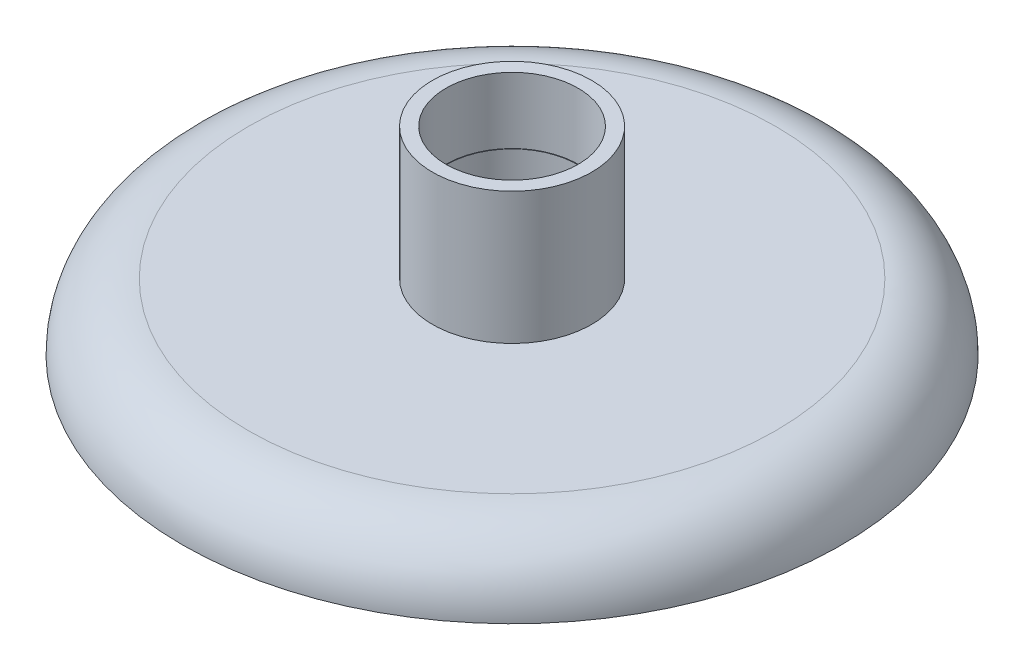
from build123d import *

# Parameters (mm, degrees)
SKETCH1_R           = 63.475313381
BOSS_EXTRUDE1_DEPTH = 12.7
FILLET2_R           = 12.7
SHELL2_T            = -6.35
SKETCH2_R           = 12.710048884
CUT_EXTRUDE1_DEPTH  = 12.7
SKETCH4_R           = 15.331222423
BOSS_EXTRUDE2_DEPTH = 25.4
SKETCH5_R           = 12.620209495
CUT_EXTRUDE2_DEPTH  = 27.94
SKETCH11_R          = 12.723642388
CUT_EXTRUDE4_DEPTH  = 12.7


with BuildPart() as part:
    # Sketch1 → Boss-Extrude1 (new body)
    with BuildSketch(Plane(origin=(0, 0, 0), x_dir=(1, 0, 0), z_dir=(0, 1, 0))):
        with Locations(Location((0, 0, 0), (0, 0, 270))):
            Circle(SKETCH1_R)
    extrude(amount=BOSS_EXTRUDE1_DEPTH)

    # Fillet2
    fillet2_edges = [part.edges().sort_by_distance(p)[0] for p in [
        (0, 12.7, -63.475313381),
    ]]
    fillet(fillet2_edges, radius=FILLET2_R - 0.0001)  # a hair under: the kernel refuses the full size

    # Shell2
    shell2_openings = [part.faces().sort_by_distance(p)[0] for p in [
        (0, 0, 0),
    ]]
    offset(amount=SHELL2_T, openings=shell2_openings)

    # Sketch2 → Cut-Extrude1 (cut)
    with BuildSketch(Plane(origin=(0, 0, 0), x_dir=(1, 0, 0), z_dir=(0, 1, 0))):
        with Locations(Location((0, 0, 0), (0, 0, 270))):
            Circle(SKETCH2_R)
    extrude(amount=CUT_EXTRUDE1_DEPTH, mode=Mode.SUBTRACT)

    # Sketch4 → Boss-Extrude2 (add)
    with BuildSketch(Plane(origin=(0, 12.7, 0), x_dir=(1, 0, 0), z_dir=(0, 1, 0))):
        with Locations(Location((0, 0, 0), (0, 0, 90))):
            Circle(SKETCH4_R)
    extrude(amount=BOSS_EXTRUDE2_DEPTH)

    # Sketch5 → Cut-Extrude2 (cut)
    with BuildSketch(Plane(origin=(0, 0, 0), x_dir=(1, 0, 0), z_dir=(0, 1, 0))):
        with Locations(Location((0, 0, 0), (0, 0, 270))):
            Circle(SKETCH5_R)
    extrude(amount=CUT_EXTRUDE2_DEPTH, mode=Mode.SUBTRACT)

    # Sketch11 → Cut-Extrude4 (cut)
    with BuildSketch(Plane(origin=(0, 38.1, 0), x_dir=(1, 0, 0), z_dir=(0, 1, 0))):
        with Locations(Location((0, 0, 0), (0, 0, 270))):
            Circle(SKETCH11_R)
    extrude(amount=-CUT_EXTRUDE4_DEPTH, mode=Mode.SUBTRACT)


solid = part.part
